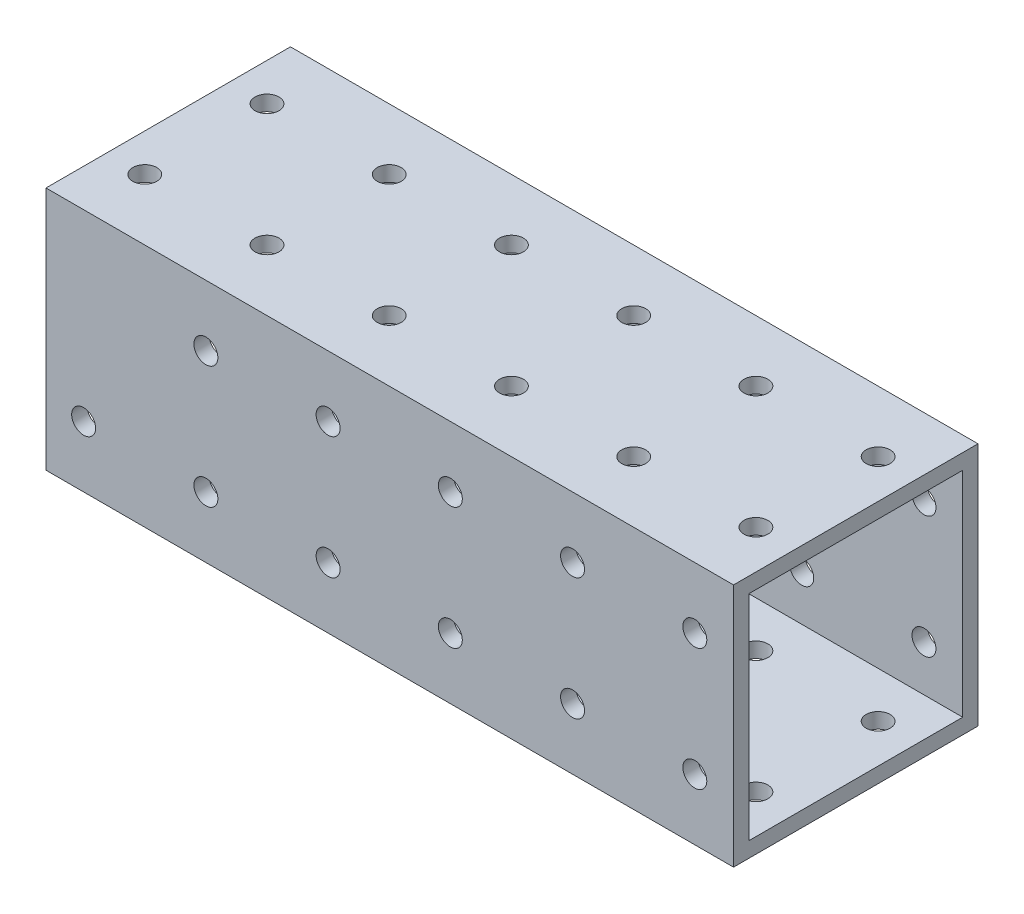
from build123d import *

# Parameters (mm, degrees)
SKETCH1_W           = 50.8
SKETCH1_H           = 50.8
BOSS_EXTRUDE1_DEPTH = 142.875
SHELL1_T            = -3.175
SKETCH2_R           = 2.4892
CUT_EXTRUDE1_DEPTH  = 160.920435295
SKETCH3_R           = 2.4892
CUT_EXTRUDE2_DEPTH  = 160.920435295


with BuildPart() as part:
    # Sketch1 → Boss-Extrude1 (new body)
    with BuildSketch(Plane(origin=(0, 0, 0), x_dir=(0, 0, -1), z_dir=(1, 0, 0))):
        with Locations((25.4, 25.4)):
            Rectangle(SKETCH1_W, SKETCH1_H)
    extrude(amount=BOSS_EXTRUDE1_DEPTH)

    # Shell1
    shell1_openings = [part.faces().sort_by_distance(p)[0] for p in [
        (0, 25.4, -25.4),
        (142.875, 25.4, -25.4),
    ]]
    offset(amount=SHELL1_T, openings=shell1_openings, kind=Kind.INTERSECTION)

    # Sketch2 → Cut-Extrude1 (cut, through all)
    with BuildSketch(Plane(origin=(0, 0, -50.8), x_dir=(-1, 0, 0), z_dir=(0, 0, -1))):
        with Locations((-33.2232, 38.1)):
            Circle(SKETCH2_R)
        with Locations((-58.6232, 38.1)):
            Circle(SKETCH2_R)
        with Locations((-84.0232, 38.1)):
            Circle(SKETCH2_R)
        with Locations((-109.4232, 38.1)):
            Circle(SKETCH2_R)
        with Locations((-134.8232, 38.1)):
            Circle(SKETCH2_R)
        with Locations((-33.2232, 12.7)):
            Circle(SKETCH2_R)
        with Locations((-58.6232, 12.7)):
            Circle(SKETCH2_R)
        with Locations((-84.0232, 12.7)):
            Circle(SKETCH2_R)
        with Locations((-109.4232, 12.7)):
            Circle(SKETCH2_R)
        with Locations((-134.8232, 12.7)):
            Circle(SKETCH2_R)
        with Locations((-7.8232, 12.7)):
            Circle(SKETCH2_R)
    extrude(amount=-CUT_EXTRUDE1_DEPTH, mode=Mode.SUBTRACT)

    # Sketch3 → Cut-Extrude2 (cut, through all)
    with BuildSketch(Plane.XZ):
        with Locations((134.8232, -12.7)):
            Circle(SKETCH3_R)
        with Locations((109.4232, -12.7)):
            Circle(SKETCH3_R)
        with Locations((84.0232, -12.7)):
            Circle(SKETCH3_R)
        with Locations((58.6232, -12.7)):
            Circle(SKETCH3_R)
        with Locations((33.2232, -12.7)):
            Circle(SKETCH3_R)
        with Locations((7.8232, -12.7)):
            Circle(SKETCH3_R)
        with Locations((109.4232, -38.1)):
            Circle(SKETCH3_R)
        with Locations((84.0232, -38.1)):
            Circle(SKETCH3_R)
        with Locations((58.6232, -38.1)):
            Circle(SKETCH3_R)
        with Locations((33.2232, -38.1)):
            Circle(SKETCH3_R)
        with Locations((7.8232, -38.1)):
            Circle(SKETCH3_R)
        with Locations((134.8232, -38.1)):
            Circle(SKETCH3_R)
    extrude(amount=-CUT_EXTRUDE2_DEPTH, mode=Mode.SUBTRACT)


solid = part.part
